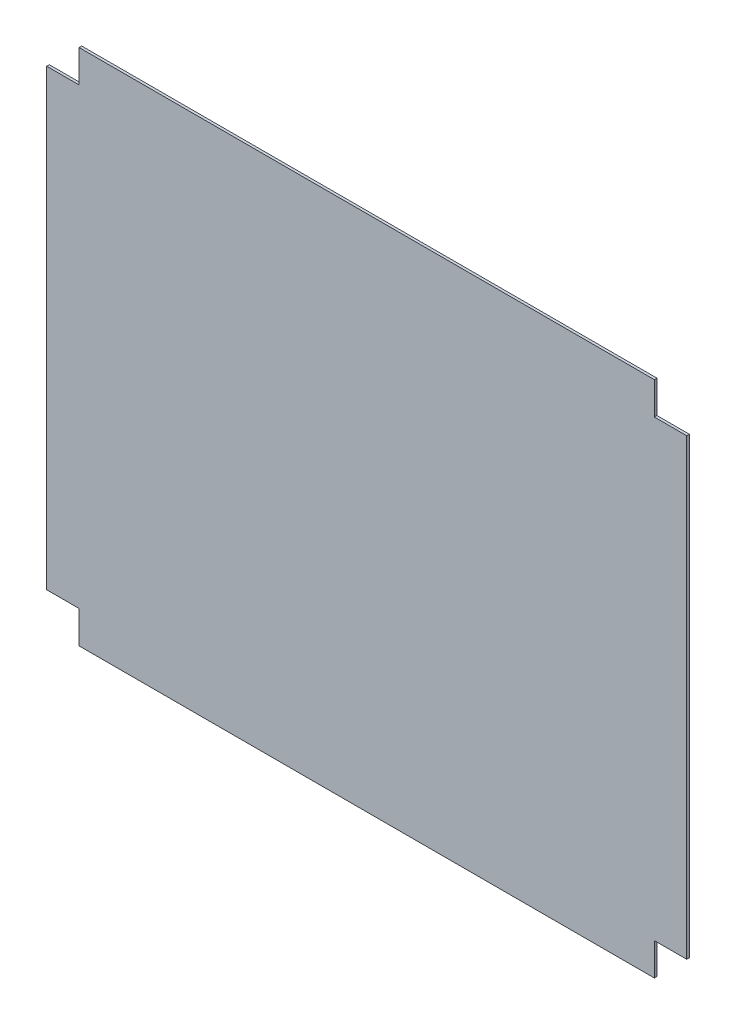
from build123d import *

# Parameters (mm, degrees)
IZIM1_W               = 494
IZIM1_H               = 400
TABAN_FLAN_1_DEPTH    = 2
IZIM6_W               = 25
IZIM6_H               = 25
KES_EKSTR_ZYON1_DEPTH = 10


# Sheet-metal steps are written as plain solids
with BuildPart() as part:
    # Çizim1 → Taban-Flanş1 (new body)
    with BuildSketch(Plane.XY):
        with Locations((0, 200)):
            Rectangle(IZIM1_W, IZIM1_H)
    extrude(amount=-TABAN_FLAN_1_DEPTH)

    # Çizim6 → Kes-Ekstrüzyon1 (cut)
    with BuildSketch(Plane.XY):
        with Locations((-234.5, 387.5)):
            Rectangle(IZIM6_W, IZIM6_H)
        with Locations((234.5, 387.5)):
            Rectangle(IZIM6_W, IZIM6_H)
        with Locations((234.5, 12.5)):
            Rectangle(IZIM6_W, IZIM6_H)
        with Locations((-234.5, 12.5)):
            Rectangle(IZIM6_W, IZIM6_H)
    extrude(amount=-KES_EKSTR_ZYON1_DEPTH, mode=Mode.SUBTRACT)


solid = part.part
